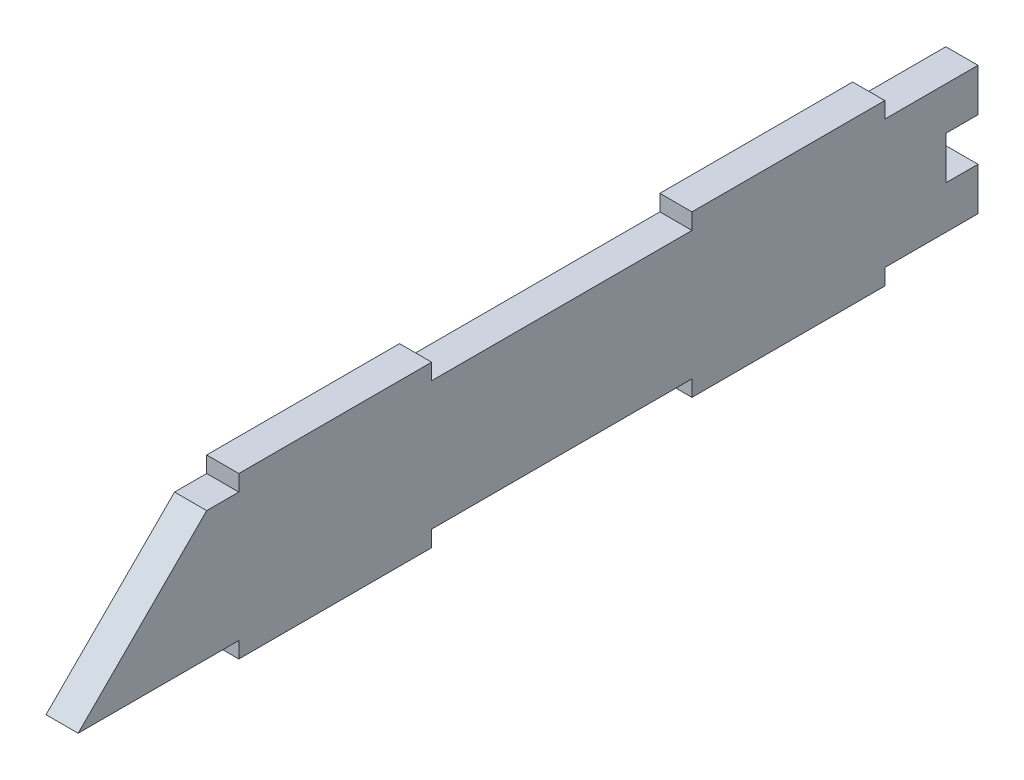
from build123d import *

# Parameters (mm, degrees)
SKETCH1_W               = 355.6
SKETCH1_H               = 50.8
BOSS_EXTRUDE1_DEPTH     = 12.7
CUT_EXTRUDE1_DEPTH      = 181.05357536
CUT_EXTRUDE1_DEPTH_BACK = 181.05357536
SKETCH3_W               = 76.2
SKETCH3_H               = 6.35
BOSS_EXTRUDE2_DEPTH     = 12.7
SKETCH4_W               = 12.7
SKETCH4_H               = 16.933333334
CUT_EXTRUDE2_DEPTH      = 182.058533353


with BuildPart() as part:
    # Sketch1 → Boss-Extrude1 (new body)
    with BuildSketch(Plane(origin=(0, 0, 0), x_dir=(0, 0, -1), z_dir=(1, 0, 0))):
        Rectangle(SKETCH1_W, SKETCH1_H)
    extrude(amount=BOSS_EXTRUDE1_DEPTH)

    # Sketch2 → Cut-Extrude1 (cut, two sides: drawn at the far end of the back side and taken through both)
    with BuildSketch(Plane(origin=(12.7, 0, 0), x_dir=(0, 0, -1), z_dir=(1, 0, 0)).offset(-CUT_EXTRUDE1_DEPTH_BACK)):
        Polygon((-692.871067812, -540.471067812), (-177.8, -25.4), (-127, 25.4), (388.071067812, 540.471067812), (-642.071067812, 1570.613203436), (-1723.013203436, 489.671067812), align=None)
    extrude(amount=CUT_EXTRUDE1_DEPTH + CUT_EXTRUDE1_DEPTH_BACK, mode=Mode.SUBTRACT)

    # Sketch3 → Boss-Extrude2 (add)
    with BuildSketch(Plane.ZY):
        with Locations((-102.87, -28.575)):
            Rectangle(SKETCH3_W, SKETCH3_H)
        with Locations((76.2, -28.575)):
            Rectangle(SKETCH3_W, SKETCH3_H)
        with Locations((-102.87, 28.575)):
            Rectangle(SKETCH3_W, SKETCH3_H)
        with Locations((76.2, 28.575)):
            Rectangle(SKETCH3_W, SKETCH3_H)
    extrude(amount=-BOSS_EXTRUDE2_DEPTH)

    # Sketch4 → Cut-Extrude2 (cut, through all)
    with BuildSketch(Plane.ZY):
        with Locations((-171.45, 0)):
            Rectangle(SKETCH4_W, SKETCH4_H)
    extrude(amount=-CUT_EXTRUDE2_DEPTH, mode=Mode.SUBTRACT)


solid = part.part
